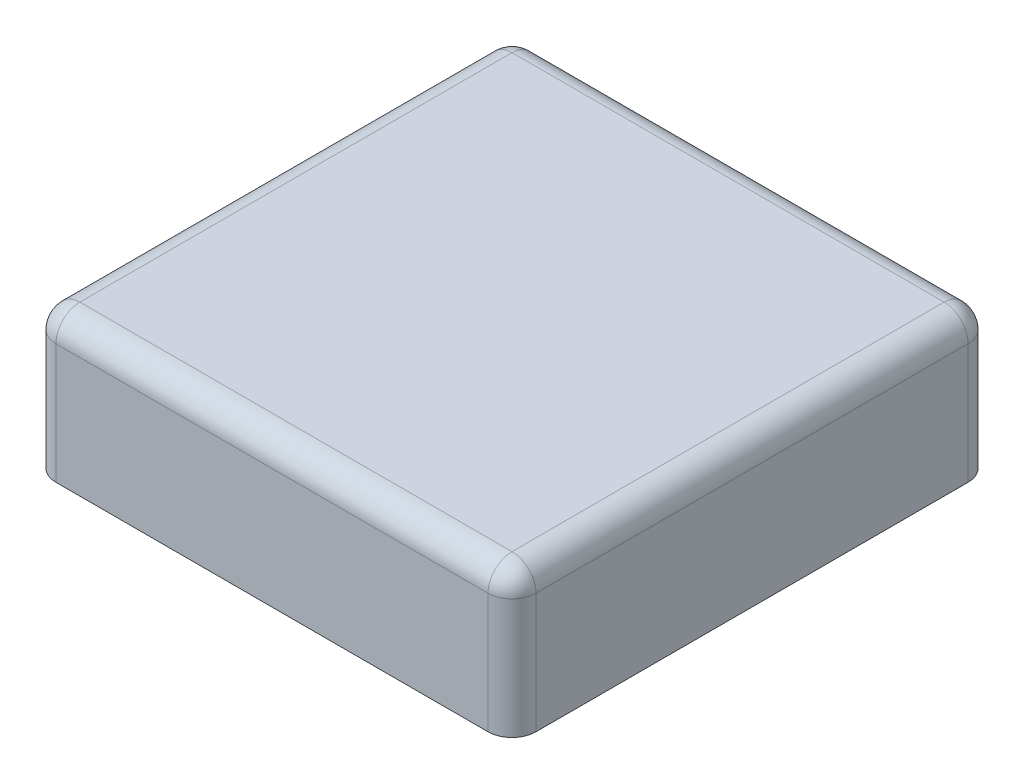
from build123d import *

# Parameters (mm, degrees)
SKETCH1_W             = 10
SKETCH1_H             = 10
BOSS_EXTRUDE2_DEPTH   = 3
SHELL2_T              = -0.7
FILLET2_R             = 0.5
BOSS_EXTRUDE3_DEPTH   = 2.5
BOSS_EXTRUDE3_2_DEPTH = 2.5
SKETCH6_W             = 0.8
SKETCH6_H             = 3.8
BOSS_EXTRUDE4_DEPTH   = 1
SKETCH7_W             = 1.5
SKETCH7_H             = 2.2
BOSS_EXTRUDE5_DEPTH   = 0.35
SKETCH9_W             = 1.8
SKETCH9_H             = 2.2
BOSS_EXTRUDE6_DEPTH   = 0.35


with BuildPart() as part:
    # Sketch1 → Boss-Extrude2 (new body)
    with BuildSketch(Plane(origin=(0, 0, 0), x_dir=(1, 0, 0), z_dir=(0, 1, 0))):
        Rectangle(SKETCH1_W, SKETCH1_H)
    extrude(amount=-BOSS_EXTRUDE2_DEPTH)

    # Shell2
    shell2_openings = [part.faces().sort_by_distance(p)[0] for p in [
        (0, -3, 0),
    ]]
    offset(amount=SHELL2_T, openings=shell2_openings, kind=Kind.INTERSECTION)

    # Fillet2
    fillet2_edges = [part.edges().sort_by_distance(p)[0] for p in [
        (0, 0, 5),
        (-5, 0, 0),
        (0, 0, -5),
        (5, 0, 0),
        (-5, -1.5, -5),
        (5, -1.5, -5),
        (5, -1.5, 5),
        (-5, -1.5, 5),
    ]]
    fillet(fillet2_edges, radius=FILLET2_R)

    # Sketch6 → Boss-Extrude4 (add, symmetric)
    with BuildSketch(Plane.XY):
        with Locations((2.3, -2.4)):
            Rectangle(SKETCH6_W, SKETCH6_H)
        with Locations((-2.3, -2.4)):
            Rectangle(SKETCH6_W, SKETCH6_H)
    extrude(amount=BOSS_EXTRUDE4_DEPTH, both=True)



with BuildPart() as body_2:
    # Sketch5 → Boss-Extrude3 (new, symmetric)
    with BuildSketch(Plane(origin=(0, 0, 0), x_dir=(0, 0, -1), z_dir=(1, 0, 0))):
        Polygon((3, -0.5), (3, -4.5), (2.2, -4.5), (1.683643362, -3.605644068), (2.2, -2.711288136), (2.2, -0.5), align=None)
    extrude(amount=BOSS_EXTRUDE3_DEPTH, both=True)


with BuildPart() as body_3:
    # Sketch5 → Boss-Extrude3 2 (new, symmetric)
    with BuildSketch(Plane(origin=(0, 0, 0), x_dir=(0, 0, -1), z_dir=(1, 0, 0))):
        Polygon((-2.2, -0.5), (-3, -0.5), (-3, -4.5), (-2.2, -4.5), (-1.683643362, -3.605644068), (-2.2, -2.711288136), align=None)
    extrude(amount=BOSS_EXTRUDE3_2_DEPTH, both=True)


with BuildPart() as part_1:
    add(part.part)

    add(body_2.part)  # Boss-Extrude5 merges body 2

    add(body_3.part)  # Boss-Extrude5 merges body 3
    # Sketch7 → Boss-Extrude5 (add, symmetric)
    with BuildSketch(Plane(origin=(0, 0, 0), x_dir=(0, 0, -1), z_dir=(1, 0, 0))):
        with Locations((-3.75, -1.6)):
            Rectangle(SKETCH7_W, SKETCH7_H)
        with Locations((3.75, -1.6)):
            Rectangle(SKETCH7_W, SKETCH7_H)
    extrude(amount=BOSS_EXTRUDE5_DEPTH, both=True)

    # Sketch9 → Boss-Extrude6 (add, symmetric)
    with BuildSketch(Plane.XY):
        with Locations((-3.6, -1.6)):
            Rectangle(SKETCH9_W, SKETCH9_H)
        with Locations((3.6, -1.6)):
            Rectangle(SKETCH9_W, SKETCH9_H)
    extrude(amount=BOSS_EXTRUDE6_DEPTH, both=True)


solid = part_1.part
